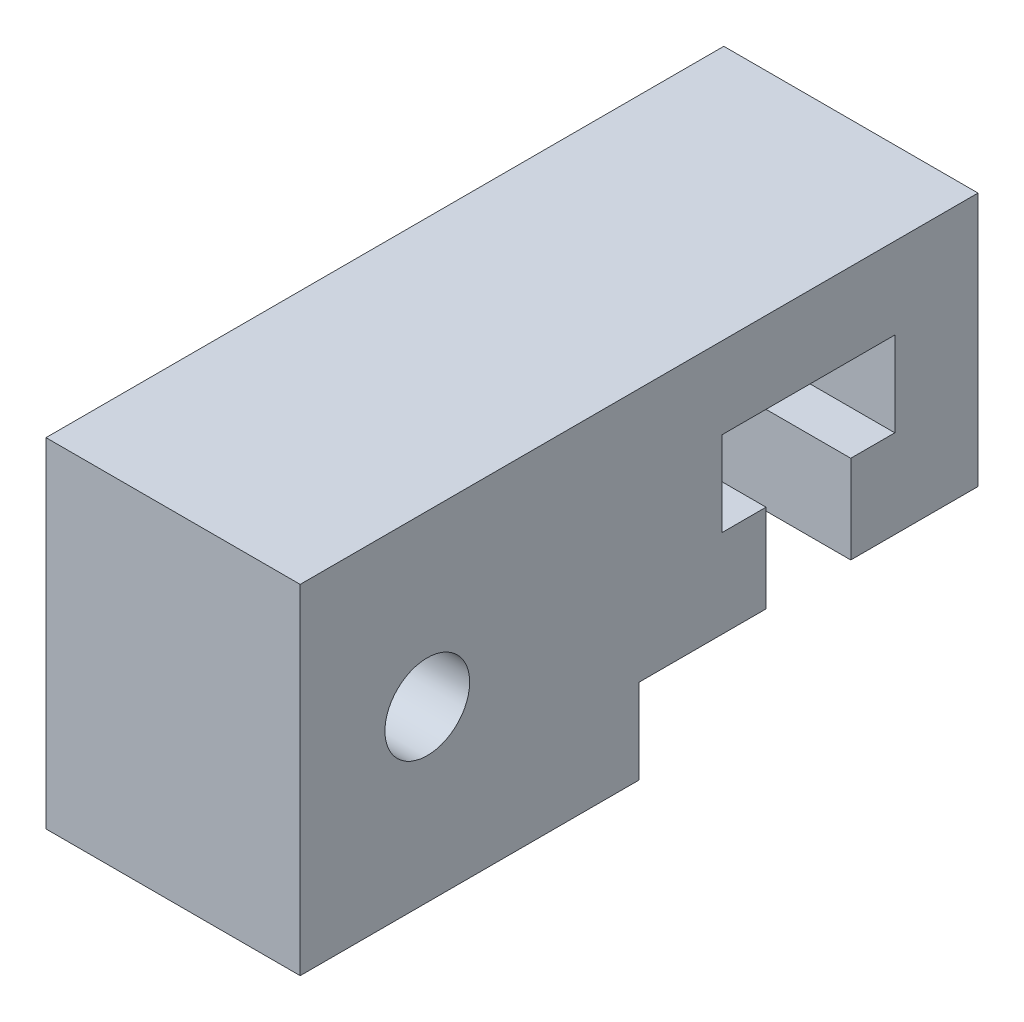
from build123d import *

# Parameters (mm, degrees)
BOSS_EXTRUDE1_DEPTH      = 4.7625
BOSS_EXTRUDE1_DEPTH_BACK = 4.7625
SKETCH2_R                = 1.5875


with BuildPart() as part:
    # Sketch2 → Boss-Extrude1 (new, two sides: drawn at the far end of the back side and taken through both)
    with BuildSketch(Plane(origin=(0, 0, 0), x_dir=(0, 0, -1), z_dir=(1, 0, 0)).offset(-BOSS_EXTRUDE1_DEPTH_BACK)):
        Polygon((-4.7625, 6.35), (-4.7625, -6.35), (7.9375, -6.35), (7.9375, -3.175), (12.69424613, -3.175), (12.69424613, 0.127), (11.04324613, 0.127), (11.04324613, 3.302), (17.52024613, 3.302), (17.52024613, 0.127), (15.86924613, 0.127), (15.86924613, -3.175), (20.6375, -3.175), (20.6375, 6.35), align=None)
        Circle(SKETCH2_R, mode=Mode.SUBTRACT)
    extrude(amount=BOSS_EXTRUDE1_DEPTH + BOSS_EXTRUDE1_DEPTH_BACK)


solid = part.part
